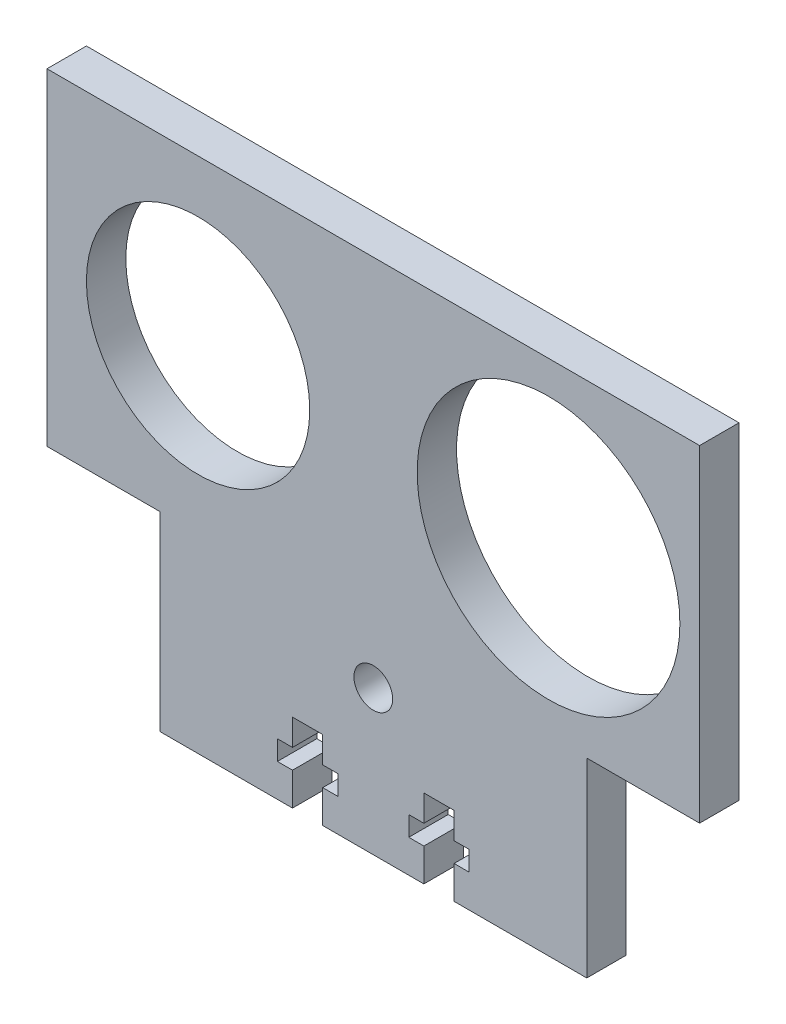
from build123d import *

# Parameters (mm, degrees)
SKETCH1_R           = 2.95
SKETCH1_R_2         = 17
SKETCH1_R_3         = 20
BOSS_EXTRUDE1_DEPTH = 6
CUT_EXTRUDE2_DEPTH  = 76.689323992


with BuildPart() as part:
    # Sketch1 → Boss-Extrude1 (new body)
    with BuildSketch(Plane.XY):
        Polygon((-32.5, 7), (-32.5, -22), (32.5, -22), (32.5, 7), (49.675685802, 7), (49.675685802, 56.790844389), (-49.675685802, 56.790844389), (-49.675685802, 7), align=None)
        Circle(SKETCH1_R, mode=Mode.SUBTRACT)
        with Locations((-26.675685802, 31.790844389)):
            Circle(SKETCH1_R_2, mode=Mode.SUBTRACT)
        with Locations((26.675685802, 31.790844389)):
            Circle(SKETCH1_R_3, mode=Mode.SUBTRACT)
    extrude(amount=BOSS_EXTRUDE1_DEPTH)

    # Sketch3 → Cut-Extrude2 (cut, through all)
    with BuildSketch(Plane.XY.offset(6)):
        Polygon((-12.3, -22), (-7.7, -22), (-7.7, -17), (-5.4, -17), (-5.4, -14), (-7.7, -14), (-7.7, -10), (-12.3, -10), (-12.3, -14), (-14.6, -14), (-14.6, -17), (-12.3, -17), align=None)
        Polygon((7.7, -14), (7.7, -10), (12.3, -10), (12.3, -14), (14.6, -14), (14.6, -17), (12.3, -17), (12.3, -22), (7.7, -22), (7.7, -17), (5.4, -17), (5.4, -14), align=None)
    extrude(amount=-CUT_EXTRUDE2_DEPTH, mode=Mode.SUBTRACT)


solid = part.part
